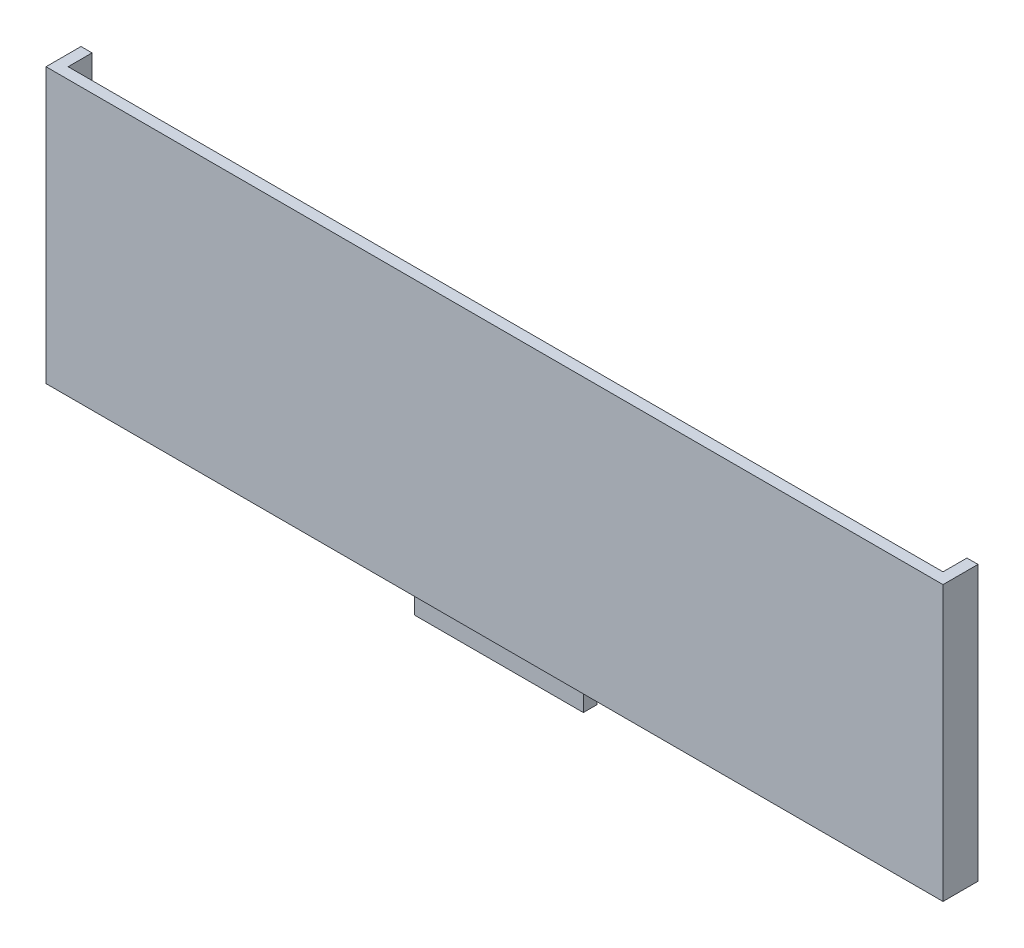
from build123d import *

# Parameters (mm, degrees)
SKETCH1_W           = 243.5
SKETCH1_H           = 9.5
BOSS_EXTRUDE1_DEPTH = 3
BOSS_EXTRUDE2_DEPTH = 74.5
SKETCH2_W           = 45.822176163
SKETCH2_H           = 3.670837316
BOSS_EXTRUDE3_DEPTH = 7


with BuildPart() as part:
    # Sketch1 → Boss-Extrude1 (new body)
    with BuildSketch(Plane(origin=(0, 0, 0), x_dir=(1, 0, 0), z_dir=(0, 1, 0))):
        with Locations((49.369672843, 59.302192067)):
            Rectangle(SKETCH1_W, SKETCH1_H)
    extrude(amount=BOSS_EXTRUDE1_DEPTH)

    # Sketch1<3> → Boss-Extrude2 (add)
    with BuildSketch(Plane(origin=(0, 0, 0), x_dir=(1, 0, 0), z_dir=(0, 1, 0))):
        Polygon((-69.380327157, 64.052192067), (-72.380327157, 64.052192067), (-72.380327157, 54.552192067), (171.119672843, 54.552192067), (171.119672843, 64.052192067), (168.119672843, 64.052192067), (168.119672843, 57.552192067), (-69.380327157, 57.552192067), align=None)
    extrude(amount=BOSS_EXTRUDE2_DEPTH)

    # Sketch2 → Boss-Extrude3 (add)
    with BuildSketch(Plane.XZ):
        with Locations((47.977286275, -58.985740574)):
            Rectangle(SKETCH2_W, SKETCH2_H)
    extrude(amount=BOSS_EXTRUDE3_DEPTH)


solid = part.part
